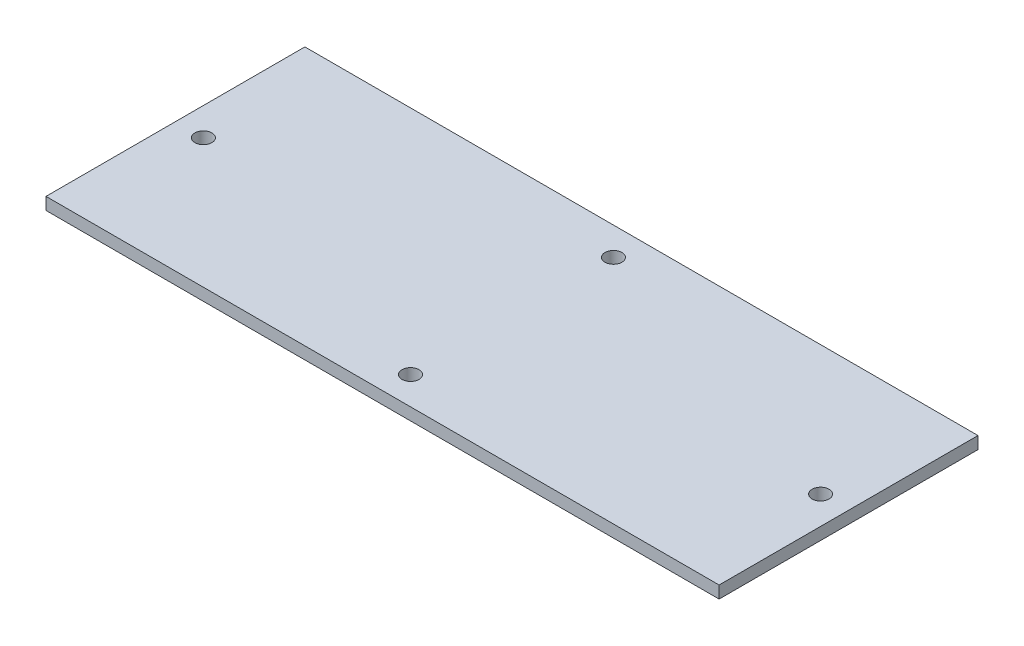
from build123d import *

# Parameters (mm, degrees)
SKETCH1_W           = 165.1
SKETCH1_H           = 63.5
BOSS_EXTRUDE1_DEPTH = 3
SKETCH3_R           = 2.0828
CUT_EXTRUDE2_DEPTH  = 5.08


with BuildPart() as part:
    # Sketch1 → Boss-Extrude1 (new body)
    with BuildSketch(Plane(origin=(0, 0, 0), x_dir=(1, 0, 0), z_dir=(0, 1, 0))):
        Rectangle(SKETCH1_W, SKETCH1_H)
    extrude(amount=BOSS_EXTRUDE1_DEPTH)

    # Sketch3 → Cut-Extrude2 (cut)
    with BuildSketch(Plane(origin=(0, 3, 0), x_dir=(1, 0, 0), z_dir=(0, 1, 0))):
        with Locations((-75.692, 0)):
            Circle(SKETCH3_R)
        with Locations((75.692, 0)):
            Circle(SKETCH3_R)
        with Locations((0, -24.892)):
            Circle(SKETCH3_R)
        with Locations((0, 24.892)):
            Circle(SKETCH3_R)
    extrude(amount=-CUT_EXTRUDE2_DEPTH, mode=Mode.SUBTRACT)


solid = part.part
